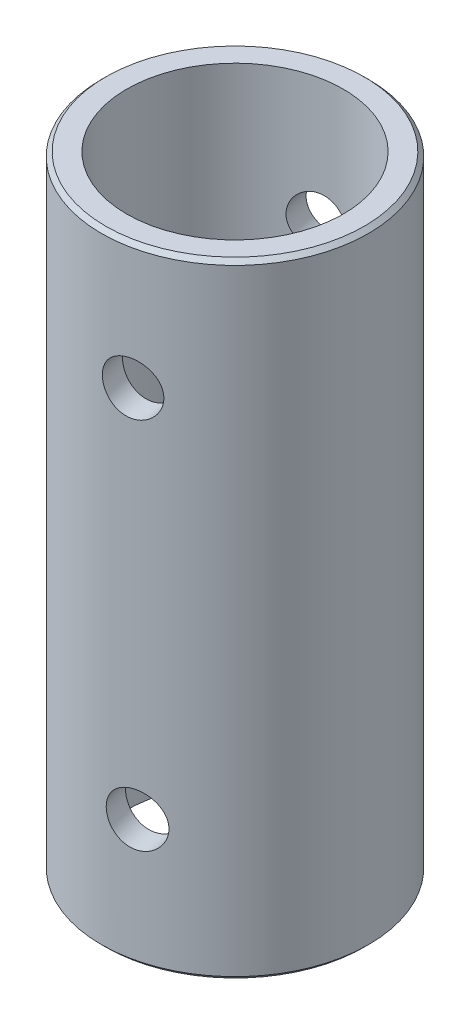
from build123d import *

# Parameters (mm, degrees)
SKETCH1_R               = 7.94
SKETCH1_R_2             = 6.44
BOSS_EXTRUDE1_DEPTH     = 37.13
CHAMFER1_SIZE           = 0.25
CUT_EXTRUDE1_DEPTH      = 41.628479229
CUT_EXTRUDE1_DEPTH_BACK = 41.628479229
SKETCH2_R               = 1.55
CUT_EXTRUDE2_DEPTH      = 41.60359728
CUT_EXTRUDE2_DEPTH_BACK = 41.60359728
SKETCH3_R               = 1.55


with BuildPart() as part:
    # Sketch1 → Boss-Extrude1 (new body)
    with BuildSketch(Plane(origin=(0, 0, 0), x_dir=(1, 0, 0), z_dir=(0, 1, 0))):
        Circle(SKETCH1_R)
        Circle(SKETCH1_R_2, mode=Mode.SUBTRACT)
    extrude(amount=BOSS_EXTRUDE1_DEPTH)

    # Chamfer1
    chamfer1_edges = [part.edges().sort_by_distance(p)[0] for p in [
        (-7.94, 0, 0),
        (-7.94, 37.13, 0),
    ]]
    chamfer(chamfer1_edges, length=CHAMFER1_SIZE)

    # Sketch2 → Cut-Extrude1 (cut, two sides: drawn at the far end of the back side and taken through both)
    with BuildSketch(Plane(origin=(-1.341603217, 0, -5.694084721), x_dir=(-0.9733478155484192, 0, 0.2293338831640899), z_dir=(-0.2293338831640899, 0, -0.9733478155484192)).offset(-CUT_EXTRUDE1_DEPTH_BACK)):
        with Locations((0, 7.5)):
            Circle(SKETCH2_R)
    extrude(amount=CUT_EXTRUDE1_DEPTH + CUT_EXTRUDE1_DEPTH_BACK, mode=Mode.SUBTRACT)

    # Sketch3 → Cut-Extrude2 (cut, two sides: drawn at the far end of the back side and taken through both)
    with BuildSketch(Plane(origin=(-1.178301637, 0, -5.730105169), x_dir=(-0.9795051571578837, 0, 0.2014190832595305), z_dir=(-0.20141908325953053, 0, -0.9795051571578838)).offset(-CUT_EXTRUDE2_DEPTH_BACK)):
        with Locations((0, 29.63)):
            Circle(SKETCH3_R)
    extrude(amount=CUT_EXTRUDE2_DEPTH + CUT_EXTRUDE2_DEPTH_BACK, mode=Mode.SUBTRACT)


solid = part.part
